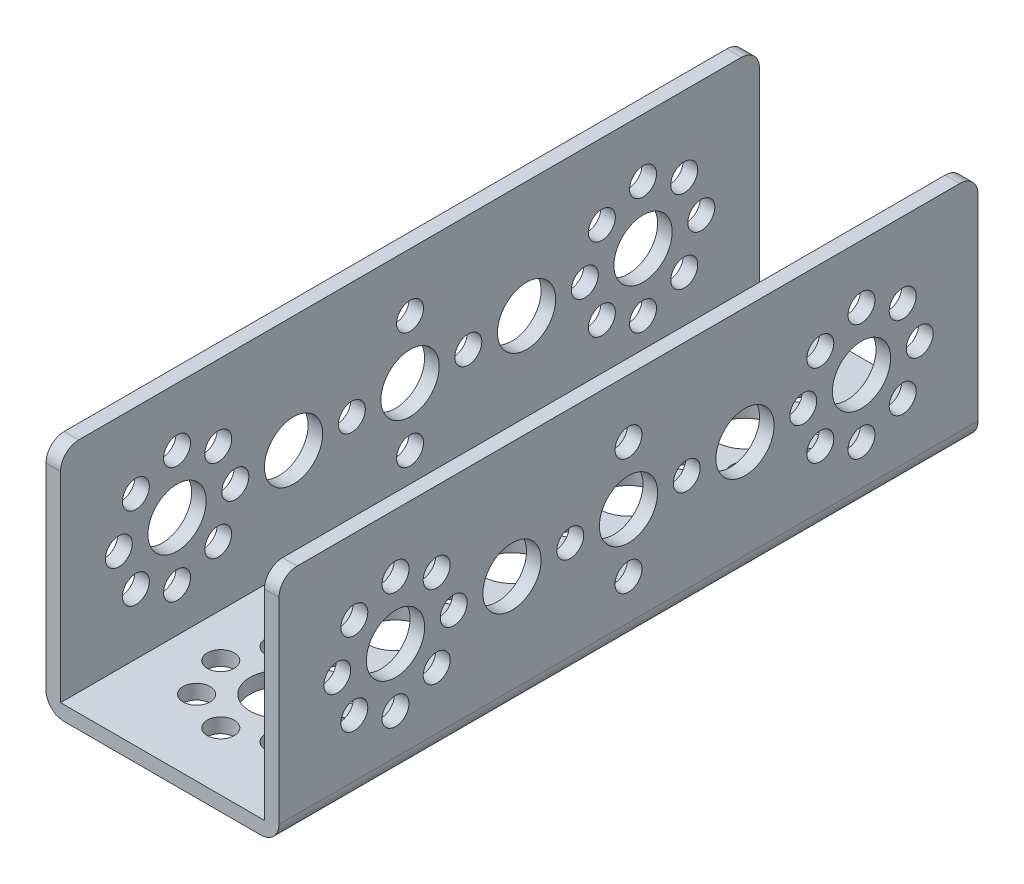
from build123d import *

# Parameters (mm, degrees)
SKETCH1_W                      = 96
SKETCH1_H                      = 32
BOSS_EXTRUDE1_DEPTH            = 32
SKETCH2_W                      = 28
SKETCH2_H                      = 30
CUT_EXTRUDE1_DEPTH             = 103.449987799
F_8_0_8_DIAMETER_HOLE1_D       = 8
F_8_0_8_DIAMETER_HOLE1_DEPTH   = 2
F_3_7_3_7_DIAMETER_HOLE1_D     = 3.7
F_3_7_3_7_DIAMETER_HOLE1_DEPTH = 2
F_3_7_3_7_DIAMETER_HOLE2_D     = 3.7
F_3_7_3_7_DIAMETER_HOLE2_DEPTH = 32
F_8_0_8_DIAMETER_HOLE2_D       = 8
F_8_0_8_DIAMETER_HOLE2_DEPTH   = 32
F_8_0_8_DIAMETER_HOLE3_D       = 8
F_8_0_8_DIAMETER_HOLE4_D       = 8
F_8_0_8_DIAMETER_HOLE4_DEPTH   = 32
F_3_7_3_7_DIAMETER_HOLE3_D     = 3.7
F_3_7_3_7_DIAMETER_HOLE3_DEPTH = 32
FILLET1_R                      = 2.5


with BuildPart() as part:
    # Sketch1 → Boss-Extrude1 (new body)
    with BuildSketch(Plane(origin=(16, 0, 0), x_dir=(0, 0, -1), z_dir=(1, 0, 0))):
        with Locations((32, 16)):
            Rectangle(SKETCH1_W, SKETCH1_H)
    extrude(amount=-BOSS_EXTRUDE1_DEPTH)

    # Sketch2 → Cut-Extrude1 (cut, through all)
    with BuildSketch(Plane(origin=(0, 0, -80), x_dir=(-1, 0, 0), z_dir=(0, 0, -1))):
        with Locations((0, 17)):
            Rectangle(SKETCH2_W, SKETCH2_H)
    extrude(amount=-CUT_EXTRUDE1_DEPTH, mode=Mode.SUBTRACT)

    # Ø8.0 (8) Diameter Hole1
    with Locations(Plane.ZY.offset(16)):
        with Locations((-64, 16), (-32, 16), (-16, 16), (-48, 16), (0, 16)):
            Hole(F_8_0_8_DIAMETER_HOLE1_D / 2, depth=F_8_0_8_DIAMETER_HOLE1_DEPTH)

    # Ø3.7 (3.7) Diameter Hole1
    with Locations(Plane.ZY.offset(16)):
        with Locations((0, 24), (0, 8), (-8, 16), (8, 16), (-5.656854249, 21.656854249), (5.656854249, 21.656854249), (5.656854249, 10.343145751), (-5.656854249, 10.343145751), (-64, 24), (-64, 8), (-72, 16), (-56, 16), (-69.656854249, 21.656854249), (-58.343145751, 21.656854249), (-58.343145751, 10.343145751), (-69.656854249, 10.343145751), (-32, 24), (-40, 16), (-32, 8), (-24, 16)):
            Hole(F_3_7_3_7_DIAMETER_HOLE1_D / 2, depth=F_3_7_3_7_DIAMETER_HOLE1_DEPTH)

    # Ø3.7 (3.7) Diameter Hole2
    with Locations(Plane(origin=(0, 0, 0), x_dir=(-1, 0, 0), z_dir=(0, -1, 0))):
        with Locations((8, 0), (5.656854249, 5.656854249), (0, 8), (-5.656854249, 5.656854249), (-8, 0), (-5.656854249, -5.656854249), (0, -8), (5.656854249, -5.656854249), (8, 64), (5.656854249, 69.656854249), (0, 72), (-5.656854249, 69.656854249), (-8, 64), (-5.656854249, 58.343145751), (0, 56), (5.656854249, 58.343145751), (8, 32), (0, 40), (-8, 32), (0, 24)):
            Hole(F_3_7_3_7_DIAMETER_HOLE2_D / 2, depth=F_3_7_3_7_DIAMETER_HOLE2_DEPTH)

    # Ø8.0 (8) Diameter Hole2
    with Locations(Plane(origin=(0, 0, 0), x_dir=(-1, 0, 0), z_dir=(0, -1, 0))):
        with Locations((0, 0), (0, 64), (0, 32), (0, 16), (0, 48)):
            Hole(F_8_0_8_DIAMETER_HOLE2_D / 2, depth=F_8_0_8_DIAMETER_HOLE2_DEPTH)

    # Ø8.0 (8) Diameter Hole3 (through all)
    with Locations(Plane.ZY.offset(-14)):
        with Locations((-32, 16)):
            Hole(F_8_0_8_DIAMETER_HOLE3_D / 2)

    # Ø8.0 (8) Diameter Hole4
    with Locations(Plane(origin=(16, 0, 0), x_dir=(0, 0, -1), z_dir=(1, 0, 0))):
        with Locations((64, 16), (16, 16), (48, 16), (0, 16)):
            Hole(F_8_0_8_DIAMETER_HOLE4_D / 2, depth=F_8_0_8_DIAMETER_HOLE4_DEPTH)

    # Ø3.7 (3.7) Diameter Hole3
    with Locations(Plane(origin=(16, 0, 0), x_dir=(0, 0, -1), z_dir=(1, 0, 0))):
        with Locations((0, 24), (0, 8), (8, 16), (-8, 16), (5.656854249, 21.656854249), (-5.656854249, 21.656854249), (-5.656854249, 10.343145751), (5.656854249, 10.343145751), (64, 24), (64, 8), (72, 16), (56, 16), (69.656854249, 21.656854249), (58.343145751, 21.656854249), (58.343145751, 10.343145751), (69.656854249, 10.343145751), (32, 24), (40, 16), (32, 8), (24, 16)):
            Hole(F_3_7_3_7_DIAMETER_HOLE3_D / 2, depth=F_3_7_3_7_DIAMETER_HOLE3_DEPTH)

    # Fillet1
    fillet1_edges = [part.edges().sort_by_distance(p)[0] for p in [
        (-16, 0, -32),
        (-15, 32, -80),
        (-15, 32, 16),
        (16, 0, -32),
        (15, 32, 16),
        (15, 32, -80),
    ]]
    fillet(fillet1_edges, radius=FILLET1_R)


solid = part.part
